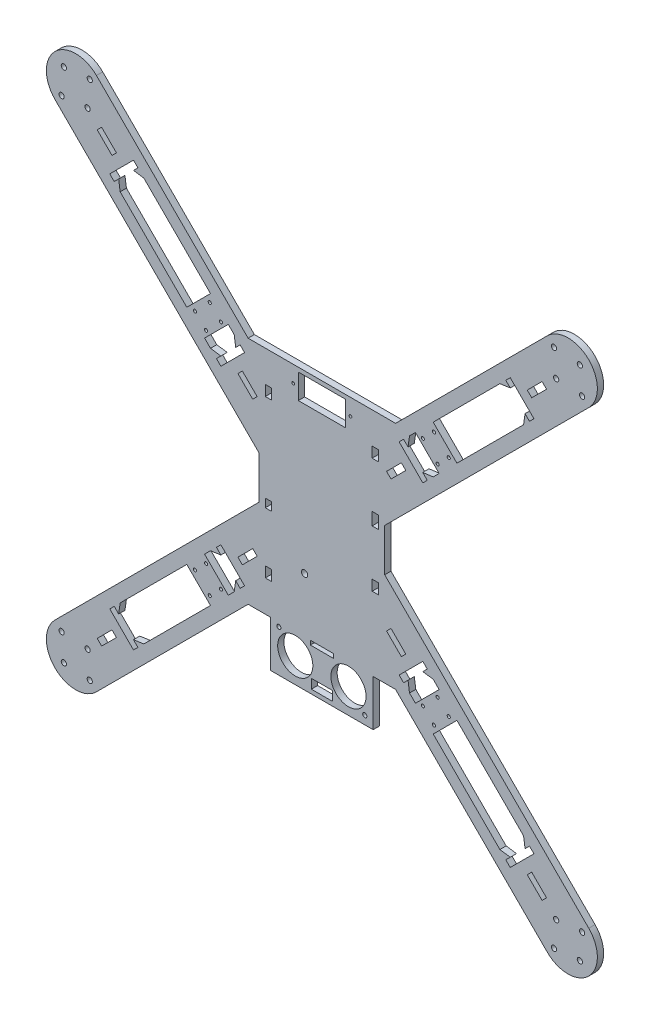
from build123d import *

# Parameters (mm, degrees)
BOSS_EXTRUDE1_DEPTH = 3
SKETCH4_R           = 1.25
CUT_EXTRUDE1_DEPTH  = 3
SKETCH5_R           = 0.65
SKETCH5_W           = 22.5
SKETCH5_H           = 11.8
CUT_EXTRUDE2_DEPTH  = 3
SKETCH6_R           = 1.5
CUT_EXTRUDE3_DEPTH  = 3
SKETCH7_R           = 1
SKETCH7_R_2         = 8.4
SKETCH7_W           = 11
SKETCH7_H           = 2
SKETCH7_W_2         = 10
SKETCH7_H_2         = 4.5
CUT_EXTRUDE4_DEPTH  = 3
CUT_EXTRUDE5_DEPTH  = 186.993279448
BOSS_EXTRUDE2_REACH = 195.992
SKETCH9_W           = 3
SKETCH9_H           = 12
BOSS_EXTRUDE3_REACH = 195.992
SKETCH11_W          = 3
SKETCH11_H          = 12
BOSS_EXTRUDE4_REACH = 195.992
SKETCH12_W          = 3
SKETCH12_H          = 12
BOSS_EXTRUDE5_REACH = 195.992
SKETCH13_W          = 3
SKETCH13_H          = 12
SKETCH14_W          = 3
SKETCH14_H          = 6
SKETCH14_H_2        = 5
SKETCH14_H_3        = 4
CUT_EXTRUDE6_DEPTH  = 186.993279448
SKETCH15_R          = 0.75
CUT_EXTRUDE7_DEPTH  = 186.993279448


with BuildPart() as part:
    # Sketch1 → Boss-Extrude1 (new body)
    with BuildSketch(Plane.XY):
        with BuildLine():
            Line((35.201010127, 55), (-35.201010127, 55))
            Line((-35.201010127, 55), (-107.600505063, 127.399494937))
            ThreePointArc((-107.600505063, 127.399494937), (-127.399494937, 127.399494937), (-127.399494937, 107.600505063))
            Line((-127.399494937, 107.600505063), (-30, 10.201010127))
            Line((-30, 10.201010127), (-30, -10.201010127))
            Line((-30, -10.201010127), (-127.399494937, -107.600505063))
            ThreePointArc((-127.399494937, -107.600505063), (-127.399494937, -127.399494937), (-107.600505063, -127.399494937))
            Line((-107.600505063, -127.399494937), (-35.201010127, -55))
            Line((-35.201010127, -55), (-24.5, -55))
            Line((-24.5, -55), (-24.5, -77))
            Line((-24.5, -77), (24.5, -77))
            Line((24.5, -77), (24.5, -55))
            Line((24.5, -55), (35.201010127, -55))
            Line((35.201010127, -55), (107.600505063, -127.399494937))
            ThreePointArc((107.600505063, -127.399494937), (127.399494937, -127.399494937), (127.399494937, -107.600505063))
            Line((127.399494937, -107.600505063), (30, -10.201010127))
            Line((30, -10.201010127), (30, 10.201010127))
            Line((30, 10.201010127), (127.399494937, 107.600505063))
            ThreePointArc((127.399494937, 107.600505063), (127.399494937, 127.399494937), (107.600505063, 127.399494937))
            Line((107.600505063, 127.399494937), (35.201010127, 55))
        make_face()
    extrude(amount=-BOSS_EXTRUDE1_DEPTH)

    # Sketch4 → Cut-Extrude1 (cut)
    with BuildSketch(Plane.XY):
        with Locations((-110.782485579, 124.217514421)):
            Circle(SKETCH4_R)
        with Locations((-124.217514421, 110.782485579)):
            Circle(SKETCH4_R)
        with Locations((-123.156854249, 123.156854249)):
            Circle(SKETCH4_R)
        with Locations((-111.843145751, 111.843145751)):
            Circle(SKETCH4_R)
        with Locations((111.843145751, 111.843145751)):
            Circle(SKETCH4_R)
        with Locations((110.782485579, 124.217514421)):
            Circle(SKETCH4_R)
        with Locations((123.156854249, 123.15685425)):
            Circle(SKETCH4_R)
        with Locations((124.217514421, 110.782485579)):
            Circle(SKETCH4_R)
        with Locations((111.843145751, -111.84314575)):
            Circle(SKETCH4_R)
        with Locations((124.217514421, -110.782485579)):
            Circle(SKETCH4_R)
        with Locations((123.15685425, -123.156854249)):
            Circle(SKETCH4_R)
        with Locations((110.782485579, -124.217514421)):
            Circle(SKETCH4_R)
        with Locations((-111.84314575, -111.843145751)):
            Circle(SKETCH4_R)
        with Locations((-110.782485579, -124.217514421)):
            Circle(SKETCH4_R)
        with Locations((-123.156854249, -123.156854249)):
            Circle(SKETCH4_R)
        with Locations((-124.217514421, -110.782485579)):
            Circle(SKETCH4_R)
    extrude(amount=-CUT_EXTRUDE1_DEPTH, mode=Mode.SUBTRACT)

    # Sketch5 → Cut-Extrude2 (cut)
    with BuildSketch(Plane.XY):
        with Locations((-13.65, 47.1)):
            Circle(SKETCH5_R)
        with Locations((13.65, 47.1)):
            Circle(SKETCH5_R)
        with Locations((0, 47.1)):
            Rectangle(SKETCH5_W, SKETCH5_H)
    extrude(amount=-CUT_EXTRUDE2_DEPTH, mode=Mode.SUBTRACT)

    # Sketch6 → Cut-Extrude3 (cut)
    with BuildSketch(Plane.XY):
        with Locations((-8.25, -28.8)):
            Circle(SKETCH6_R)
    extrude(amount=-CUT_EXTRUDE3_DEPTH, mode=Mode.SUBTRACT)

    # Sketch7 → Cut-Extrude4 (cut)
    with BuildSketch(Plane.XY):
        with Locations((-20.5, -57)):
            Circle(SKETCH7_R)
        with Locations((-12.7, -65)):
            Circle(SKETCH7_R_2)
        with Locations((12.7, -65)):
            Circle(SKETCH7_R_2)
        with Locations((20.5, -73)):
            Circle(SKETCH7_R)
        with Locations((0, -56)):
            Rectangle(SKETCH7_W, SKETCH7_H)
        with Locations((0, -72.75)):
            Rectangle(SKETCH7_W_2, SKETCH7_H_2)
    extrude(amount=-CUT_EXTRUDE4_DEPTH, mode=Mode.SUBTRACT)

    # Sketch8 → Cut-Extrude5 (cut, through all)
    with BuildSketch(Plane.XY):
        Polygon((101.236544033, -89.922835534), (89.922835534, -101.236544033), (87.80151519, -99.115223689), (89.922835534, -96.993903346), (84.973088065, -96.286796564), (41.839574413, -53.153282912), (41.132467632, -48.203535444), (39.011147288, -50.324855787), (36.889826945, -48.203535444), (48.203535444, -36.889826945), (50.324855787, -39.011147288), (48.203535444, -41.132467632), (53.153282912, -41.839574413), (96.286796564, -84.973088065), (96.993903346, -89.922835534), (99.115223689, -87.80151519), align=None)
        Polygon((40.07180746, -37.950487117), (37.950487117, -40.07180746), (30.879419305, -33.000739648), (33.000739648, -30.879419305), align=None)
        Polygon((50.324855787, 39.011147288), (48.203535444, 36.889826945), (36.889826945, 48.203535444), (39.011147288, 50.324855787), (41.132467632, 48.203535444), (41.839574413, 53.153282912), (84.973088065, 96.286796564), (89.922835534, 96.993903346), (87.80151519, 99.115223689), (89.922835534, 101.236544033), (101.236544033, 89.922835534), (99.115223689, 87.80151519), (96.993903346, 89.922835534), (96.286796564, 84.973088065), (53.153282912, 41.839574413), (48.142875272, 41.193127804), align=None)
        Polygon((100.175883861, -98.054563517), (98.054563517, -100.175883861), (105.125631329, -107.246951673), (107.246951673, -105.125631329), align=None)
        Polygon((-101.236544033, -89.922835534), (-99.115223689, -87.80151519), (-96.993903346, -89.922835534), (-96.286796564, -84.973088065), (-53.153282912, -41.839574413), (-48.203535444, -41.132467632), (-50.324855787, -39.011147288), (-48.203535444, -36.889826945), (-36.889826945, -48.203535444), (-39.011147288, -50.324855787), (-41.132467632, -48.203535444), (-41.839574413, -53.153282912), (-84.973088065, -96.286796564), (-89.922835534, -96.993903346), (-87.80151519, -99.115223689), (-89.922835534, -101.236544033), align=None)
        Polygon((-100.175883861, -98.054563517), (-107.246951673, -105.125631329), (-105.125631329, -107.246951673), (-98.054563517, -100.175883861), align=None)
        Polygon((-37.950487117, -40.07180746), (-40.07180746, -37.950487117), (-33.000739648, -30.879419305), (-30.879419305, -33.000739648), align=None)
        Polygon((-89.922835534, 101.236544033), (-87.80151519, 99.115223689), (-89.922835534, 96.993903346), (-84.973088065, 96.286796564), (-41.839574413, 53.153282912), (-41.132467632, 48.203535444), (-39.011147288, 50.324855787), (-36.889826945, 48.203535444), (-48.203535444, 36.889826945), (-50.324855787, 39.011147288), (-48.203535444, 41.132467632), (-53.153282912, 41.839574413), (-96.286796564, 84.973088065), (-96.993903346, 89.922835534), (-99.115223689, 87.80151519), (-101.236544033, 89.922835534), align=None)
        Polygon((-98.054563517, 100.175883861), (-105.125631329, 107.246951673), (-107.246951673, 105.125631329), (-100.175883861, 98.054563517), align=None)
        Polygon((-40.07180746, 37.950487117), (-37.950487117, 40.07180746), (-30.879419305, 33.000739648), (-33.000739648, 30.879419305), align=None)
        Polygon((100.175883861, 98.054563517), (107.246951673, 105.125631329), (105.125631329, 107.246951673), (98.054563517, 100.175883861), align=None)
        Polygon((37.950487117, 40.07180746), (40.07180746, 37.950487117), (33.000739648, 30.879419305), (30.879419305, 33.000739648), align=None)
    extrude(amount=-CUT_EXTRUDE5_DEPTH, mode=Mode.SUBTRACT)

    # Sketch9 → Boss-Extrude2 (add, up to next)
    with BuildSketch(Plane(origin=(-5.656854249, 5.656854249, 0), x_dir=(0, 0, -1), z_dir=(0.70710678118654, -0.707106781186555, 0)), mode=Mode.PRIVATE) as boss_extrude2_sk1:
        with Locations((1.5, 77.170093579)):
            Rectangle(SKETCH9_W, SKETCH9_H)
    boss_extrude2_tool1 = extrude(boss_extrude2_sk1.sketch, amount=BOSS_EXTRUDE2_REACH, mode=Mode.PRIVATE) - part.part
    add(boss_extrude2_tool1.solids().sort_by_distance((48.910642, 60.224351, -1.5))[0])

    # Sketch11 → Boss-Extrude3 (add, up to next)
    with BuildSketch(Plane(origin=(5.656854249, 5.656854249, 0), x_dir=(0, 0, 1), z_dir=(-0.7071067811865477, -0.7071067811865475, 0)), mode=Mode.PRIVATE) as boss_extrude3_sk1:
        with Locations((-1.5, -77.170093579)):
            Rectangle(SKETCH11_W, SKETCH11_H)
    boss_extrude3_tool1 = extrude(boss_extrude3_sk1.sketch, amount=BOSS_EXTRUDE3_REACH, mode=Mode.PRIVATE) - part.part
    add(boss_extrude3_tool1.solids().sort_by_distance((60.224351, -48.910642, -1.5))[0])

    # Sketch12 → Boss-Extrude4 (add, up to next)
    with BuildSketch(Plane(origin=(5.656854249, -5.656854249, 0), x_dir=(0, 0, 1), z_dir=(-0.7071067811865449, 0.7071067811865502, 0)), mode=Mode.PRIVATE) as boss_extrude4_sk1:
        with Locations((-1.5, -77.170093579)):
            Rectangle(SKETCH12_W, SKETCH12_H)
    boss_extrude4_tool1 = extrude(boss_extrude4_sk1.sketch, amount=BOSS_EXTRUDE4_REACH, mode=Mode.PRIVATE) - part.part
    add(boss_extrude4_tool1.solids().sort_by_distance((-48.910642, -60.224351, -1.5))[0])

    # Sketch13 → Boss-Extrude5 (add, up to next)
    with BuildSketch(Plane(origin=(5.656854249, 5.656854249, 0), x_dir=(0, 0, 1), z_dir=(-0.707106781186552, -0.707106781186543, 0)), mode=Mode.PRIVATE) as boss_extrude5_sk1:
        with Locations((-1.5, 77.170093579)):
            Rectangle(SKETCH13_W, SKETCH13_H)
    boss_extrude5_tool1 = extrude(boss_extrude5_sk1.sketch, amount=BOSS_EXTRUDE5_REACH, mode=Mode.PRIVATE) - part.part
    add(boss_extrude5_tool1.solids().sort_by_distance((-48.910642, 60.224351, -1.5))[0])

    # Sketch14 → Cut-Extrude6 (cut, through all)
    with BuildSketch(Plane(origin=(0, 0, -3), x_dir=(-1, 0, 0), z_dir=(0, 0, -1))):
        with Locations((-25.5, 10)):
            Rectangle(SKETCH14_W, SKETCH14_H)
        with Locations((25.5, -37.5)):
            Rectangle(SKETCH14_W, SKETCH14_H_2)
        with Locations((25.5, -9)):
            Rectangle(SKETCH14_W, SKETCH14_H_3)
        with Locations((25.5, 37.5)):
            Rectangle(SKETCH14_W, SKETCH14_H_2)
        with Locations((-25.5, -17.5)):
            Rectangle(SKETCH14_W, SKETCH14_H_2)
        with Locations((-25.5, 37.5)):
            Rectangle(SKETCH14_W, SKETCH14_H_2)
    extrude(amount=-CUT_EXTRUDE6_DEPTH, mode=Mode.SUBTRACT)

    # Sketch15 → Cut-Extrude7 (cut, through all)
    with BuildSketch(Plane(origin=(0, 0, -3), x_dir=(-1, 0, 0), z_dir=(0, 0, -1))):
        with Locations((-60.577904114, -53.506836303)):
            Circle(SKETCH15_R)
        with Locations((-55.274603256, -48.203535444)):
            Circle(SKETCH15_R)
        with Locations((-48.203535444, -55.274603256)):
            Circle(SKETCH15_R)
        with Locations((-53.506836303, -60.577904114)):
            Circle(SKETCH15_R)
        with Locations((-53.506836303, 60.577904114)):
            Circle(SKETCH15_R)
        with Locations((-48.203535444, 55.274603256)):
            Circle(SKETCH15_R)
        with Locations((-60.577904114, 53.506836303)):
            Circle(SKETCH15_R)
        with Locations((-55.274603256, 48.203535444)):
            Circle(SKETCH15_R)
        with Locations((60.577904114, 53.506836303)):
            Circle(SKETCH15_R)
        with Locations((55.274603256, 48.203535444)):
            Circle(SKETCH15_R)
        with Locations((53.506836303, 60.577904114)):
            Circle(SKETCH15_R)
        with Locations((48.203535444, 55.274603256)):
            Circle(SKETCH15_R)
        with Locations((53.506836303, -60.577904114)):
            Circle(SKETCH15_R)
        with Locations((48.203535444, -55.274603256)):
            Circle(SKETCH15_R)
        with Locations((60.577904114, -53.506836303)):
            Circle(SKETCH15_R)
        with Locations((55.274603256, -48.203535444)):
            Circle(SKETCH15_R)
    extrude(amount=-CUT_EXTRUDE7_DEPTH, mode=Mode.SUBTRACT)


solid = part.part
